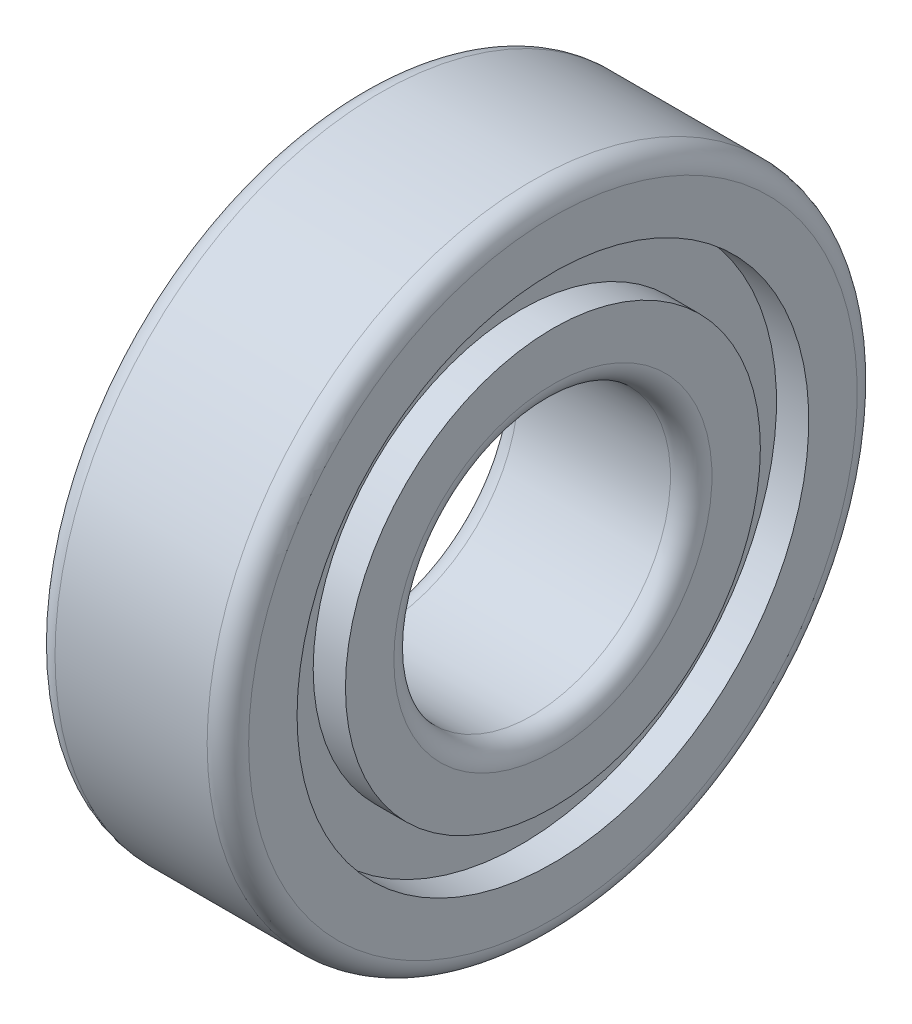
from build123d import *


with BuildPart() as part:
    # Эскиз1 → Повернуть1 (revolve)
    with BuildSketch(Plane.XY):
        with BuildLine():
            Line((5.5, 10), (-5.5, 10))
            ThreePointArc((-5.5, 10), (-6.560660172, 10.439339828), (-7, 11.5))
            Line((-7, 11.5), (-7, 15))
            Line((-7, 15), (-4.666666667, 15))
            Line((-4.666666667, 15), (-4.666666667, 18.5))
            Line((-4.666666667, 18.5), (-7, 18.5))
            Line((-7, 18.5), (-7, 22))
            ThreePointArc((-7, 22), (-6.560660172, 23.060660172), (-5.5, 23.5))
            Line((-5.5, 23.5), (5.5, 23.5))
            ThreePointArc((5.5, 23.5), (6.560660172, 23.060660172), (7, 22))
            Line((7, 22), (7, 18.5))
            Line((7, 18.5), (4.666666667, 18.5))
            Line((4.666666667, 18.5), (4.666666667, 15))
            Line((4.666666667, 15), (7, 15))
            Line((7, 15), (7, 11.5))
            ThreePointArc((7, 11.5), (6.560660172, 10.439339828), (5.5, 10))
        make_face()
    revolve(axis=Axis((-1000, 0, 0), (1, 0, 0)))


solid = part.part
